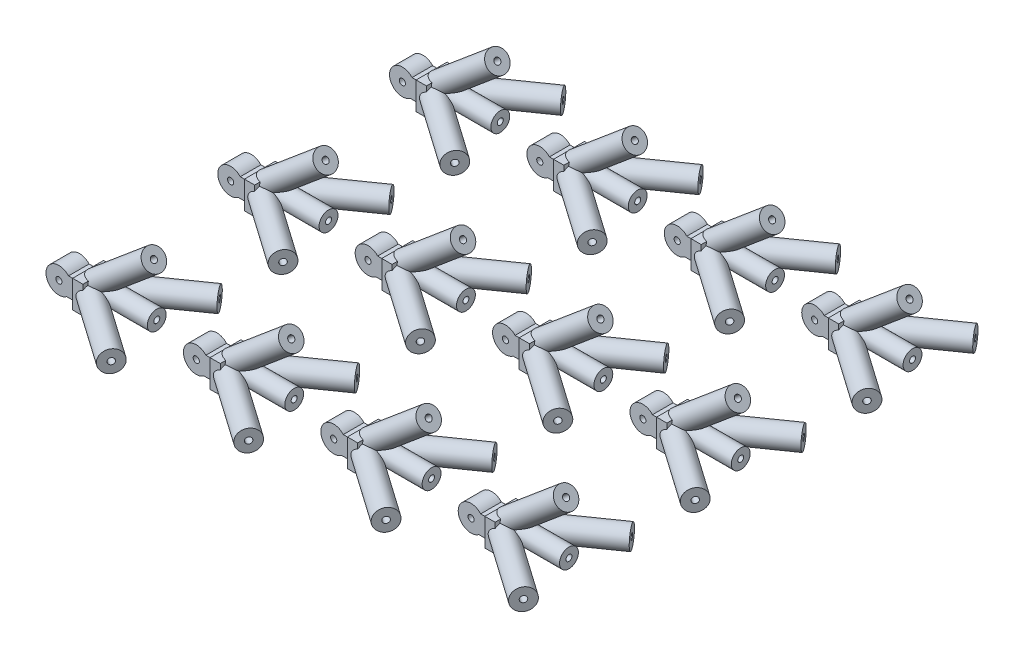
from build123d import *

# Parameters (mm, degrees)
SKETCH_2_W               = 3.6
SKETCH_2_H               = 3.2
SKETCH_2_W_2             = 1.9125
SKETCH_2_H_2             = 1.7
EXTRUDE_1_DEPTH          = 7
EXTRUDE_2_REACH          = 20.018
SKETCH_3_R               = 1.25
SKETCH_3_R_2             = 0.36
EXTRUDE_3_REACH          = 23.096
SKETCH_4_R               = 1.25
SKETCH_4_R_2             = 0.35
SKETCH_5_W               = 3.6
SKETCH_5_H               = 3.2
EXTRUDE_4_DEPTH          = 1.2
CUT_EXTRUDE_START        = -7
SKETCH_6_W               = 3.6
SKETCH_6_H               = 3.2
CUT_EXTRUDE_1_DEPTH      = 7
SKETCH_7_R               = 0.36
EXTRUDE_5_DEPTH          = 1.2
EXTRUDE_6_REACH          = 17.725
SKETCH_9_R               = 1.25
SKETCH_9_R_2             = 0.35
EXTRUDE_7_REACH          = 17.01
EXTRUDE_7_END_RADIUS     = 1.25
SKETCH_10_R              = 1.1
SKETCH_10_R_2            = 0.35
PATTERN_LINEAR_1_COUNT   = 4
PATTERN_LINEAR_1_PITCH   = 16
PATTERN_LINEAR_1_2_COUNT = 3
PATTERN_LINEAR_1_2_PITCH = 20


with BuildPart() as part:
    # 草图2 → 凸台-拉伸1 (new body)
    with BuildSketch(Plane(origin=(0, 0, 0), x_dir=(0, 0, -1), z_dir=(1, 0, 0))):
        Rectangle(SKETCH_2_W, SKETCH_2_H)
        Rectangle(SKETCH_2_W_2, SKETCH_2_H_2, mode=Mode.SUBTRACT)
    extrude(amount=-EXTRUDE_1_DEPTH)

    # 凸台-拉伸2: up to this plane
    extrude_2_end = Plane(origin=(0, 0, 0), z_dir=(-1, 0, 0))
    # 草图3 → 凸台-拉伸2 (add, up to the surface)
    with BuildSketch(Plane(origin=(9.010672487, 0, 6.3093408), x_dir=(-0.5735764363510472, 0, 0.819152044288991), z_dir=(-0.819152044288991, 0, -0.5735764363510472)), mode=Mode.PRIVATE) as extrude_2_sk1:
        Circle(SKETCH_3_R)
        Circle(SKETCH_3_R_2, mode=Mode.SUBTRACT)
    extrude_2_tool1 = split(extrude(extrude_2_sk1.sketch, amount=EXTRUDE_2_REACH, mode=Mode.PRIVATE), bisect_by=extrude_2_end, keep=Keep.BOTH, mode=Mode.PRIVATE)
    add(extrude_2_tool1.solids().sort_by_distance((9.707364, 0, 5.314362))[0])

    # 凸台-拉伸3: up to this plane
    extrude_3_end = Plane(origin=(0, 0, 0), z_dir=(-1, 0, 0))
    # 草图4 → 凸台-拉伸3 (add, up to the surface)
    with BuildSketch(Plane(origin=(9.010672487, 0, -6.3093408), x_dir=(-0.5735764363510472, 0, -0.819152044288991), z_dir=(0.819152044288991, 0, -0.5735764363510472)), mode=Mode.PRIVATE) as extrude_3_sk1:
        Circle(SKETCH_4_R)
        Circle(SKETCH_4_R_2, mode=Mode.SUBTRACT)
    extrude_3_tool1 = split(extrude(extrude_3_sk1.sketch, amount=-EXTRUDE_3_REACH, mode=Mode.PRIVATE), bisect_by=extrude_3_end, keep=Keep.BOTH, mode=Mode.PRIVATE)
    add(extrude_3_tool1.solids().sort_by_distance((9.707364, 0, -5.314362))[0])

    # 草图5 → 凸台-拉伸4 (add)
    with BuildSketch(Plane(origin=(0, 0, 0), x_dir=(0, 0, -1), z_dir=(1, 0, 0))):
        Rectangle(SKETCH_5_W, SKETCH_5_H)
    extrude(amount=EXTRUDE_4_DEPTH)

    # 草图6 → 切除-拉伸1 (cut)
    with BuildSketch(Plane.ZY.offset(7).offset(CUT_EXTRUDE_START)):
        Rectangle(SKETCH_6_W, SKETCH_6_H)
    extrude(amount=CUT_EXTRUDE_1_DEPTH, mode=Mode.SUBTRACT)

    # 草图7 → 凸台-拉伸5 (add, symmetric)
    with BuildSketch(Plane.XY):
        with BuildLine():
            Line((0, 1), (-1.081966011, 1))
            ThreePointArc((-1.081966011, 1), (-3.692687273, 0.1479348), (-1.3, -1.2))
            Line((-1.3, -1.2), (0, -1.2))
            Line((0, -1.2), (0, 1))
        make_face()
        with Locations((-2.2, 0)):
            Circle(SKETCH_7_R, mode=Mode.SUBTRACT)
    extrude(amount=EXTRUDE_5_DEPTH, both=True)

    # 凸台-拉伸6: up to this plane
    extrude_6_end = Plane(origin=(0, 0, 0), z_dir=(-1, 0, 0))
    # 草图9 → 凸台-拉伸6 (add, up to the surface)
    with BuildSketch(Plane(origin=(7.660444431, 6.427876097, 0), x_dir=(0, 0, -1), z_dir=(0.7660444431189767, 0.6427876096865409, 0)), mode=Mode.PRIVATE) as extrude_6_sk1:
        with Locations(Location((0, 0, 0), (0, 0, 90))):
            Circle(SKETCH_9_R)
        with Locations(Location((0, 0, 0), (0, 0, 90))):
            Circle(SKETCH_9_R_2, mode=Mode.SUBTRACT)
    extrude_6_tool1 = split(extrude(extrude_6_sk1.sketch, amount=-EXTRUDE_6_REACH, mode=Mode.PRIVATE), bisect_by=extrude_6_end, keep=Keep.BOTH, mode=Mode.PRIVATE)
    add(extrude_6_tool1.solids().sort_by_distance((8.441203, 5.497404, 0))[0])

    # 凸台-拉伸7: up to this cylinder (the profile starts outside it)
    extrude_7_end = Plane(origin=(4.940794649, 4.145818968, 0), z_dir=(0.7660444431189767, 0.642787609686541, 0)) * Cylinder(EXTRUDE_7_END_RADIUS, 37.52, mode=Mode.PRIVATE)
    # 草图10 → 凸台-拉伸7 (add, up to the surface)
    with BuildSketch(Plane(origin=(8, 1.5, 0), x_dir=(0, 0, -1), z_dir=(1, 0, 0)), mode=Mode.PRIVATE) as extrude_7_sk1:
        with Locations((0, -1)):
            Circle(SKETCH_10_R)
        with Locations((0, -1)):
            Circle(SKETCH_10_R_2, mode=Mode.SUBTRACT)
    extrude_7_tool1 = extrude(extrude_7_sk1.sketch, amount=-EXTRUDE_7_REACH, mode=Mode.PRIVATE) - extrude_7_end
    add(extrude_7_tool1.solids().sort_by_distance((8, 0.5, 1.068887))[0])


with BuildPart() as pattern_linear_1_1:
    # 阵列(线性)1: pattern copy
    add(part.part.moved(Location(Vector(-1, 0, 0) * (1 * PATTERN_LINEAR_1_PITCH))))


with BuildPart() as pattern_linear_1_2:
    # 阵列(线性)1: pattern copy
    add(part.part.moved(Location(Vector(-1, 0, 0) * (2 * PATTERN_LINEAR_1_PITCH))))


with BuildPart() as pattern_linear_1_3:
    # 阵列(线性)1: pattern copy
    add(part.part.moved(Location(Vector(-1, 0, 0) * (3 * PATTERN_LINEAR_1_PITCH))))


with BuildPart() as pattern_linear_1_2_1:
    # Pattern Linear 1 2: pattern copy
    add(part.part.moved(Location(Vector(0, 0, 1) * (1 * PATTERN_LINEAR_1_2_PITCH))))


with BuildPart() as pattern_linear_1_2_2:
    # Pattern Linear 1 2: pattern copy
    add(part.part.moved(Location(Vector(0, 0, 1) * (2 * PATTERN_LINEAR_1_2_PITCH))))


with BuildPart() as pattern_linear_1_2_3:
    # Pattern Linear 1 2: pattern copy
    add(pattern_linear_1_1.part.moved(Location(Vector(0, 0, 1) * (1 * PATTERN_LINEAR_1_2_PITCH))))


with BuildPart() as pattern_linear_1_2_4:
    # Pattern Linear 1 2: pattern copy
    add(pattern_linear_1_1.part.moved(Location(Vector(0, 0, 1) * (2 * PATTERN_LINEAR_1_2_PITCH))))


with BuildPart() as pattern_linear_1_2_5:
    # Pattern Linear 1 2: pattern copy
    add(pattern_linear_1_2.part.moved(Location(Vector(0, 0, 1) * (1 * PATTERN_LINEAR_1_2_PITCH))))


with BuildPart() as pattern_linear_1_2_6:
    # Pattern Linear 1 2: pattern copy
    add(pattern_linear_1_2.part.moved(Location(Vector(0, 0, 1) * (2 * PATTERN_LINEAR_1_2_PITCH))))


with BuildPart() as pattern_linear_1_2_7:
    # Pattern Linear 1 2: pattern copy
    add(pattern_linear_1_3.part.moved(Location(Vector(0, 0, 1) * (1 * PATTERN_LINEAR_1_2_PITCH))))


with BuildPart() as pattern_linear_1_2_8:
    # Pattern Linear 1 2: pattern copy
    add(pattern_linear_1_3.part.moved(Location(Vector(0, 0, 1) * (2 * PATTERN_LINEAR_1_2_PITCH))))


solid = Compound([part.part, pattern_linear_1_1.part, pattern_linear_1_2.part, pattern_linear_1_3.part, pattern_linear_1_2_1.part, pattern_linear_1_2_2.part, pattern_linear_1_2_3.part, pattern_linear_1_2_4.part, pattern_linear_1_2_5.part, pattern_linear_1_2_6.part, pattern_linear_1_2_7.part, pattern_linear_1_2_8.part])
